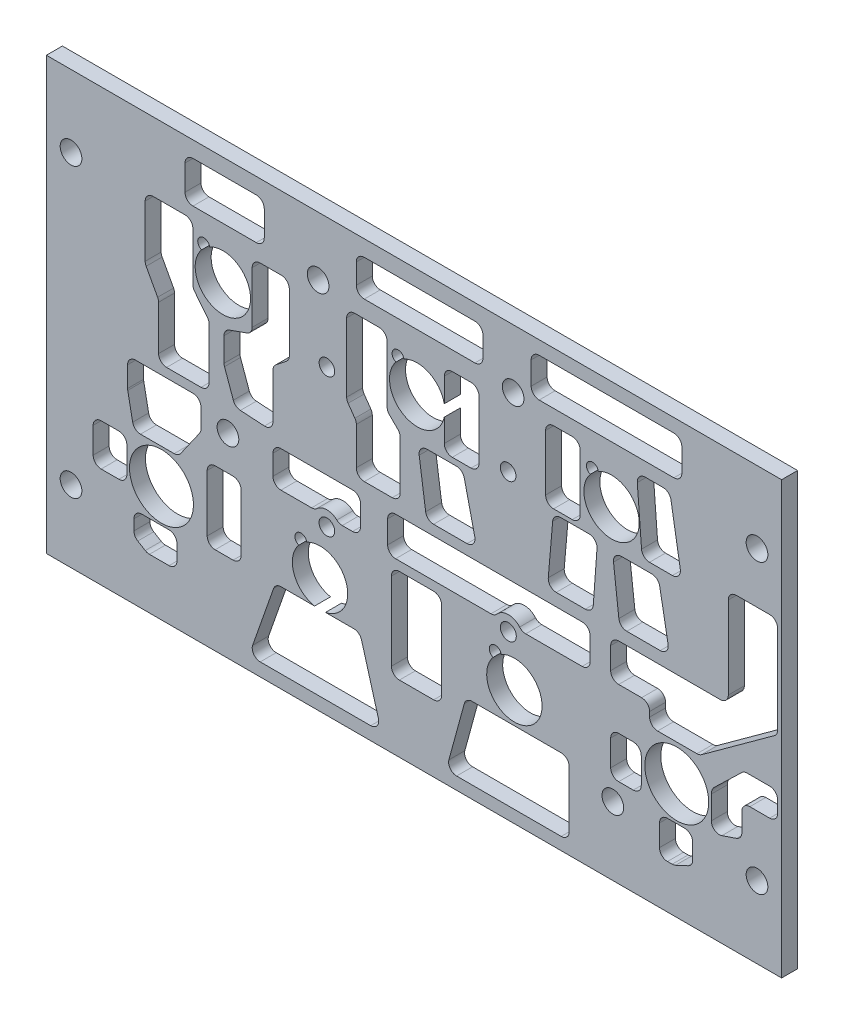
from build123d import *

# Parameters (mm, degrees)
SKETCH1_W                    = 146.05
SKETCH1_H                    = 85.725
BACKPLATE_BODY_DEPTH         = 3.175
F_6_CLEARANCE_HOLE1_D        = 4.3053
F_6_CLEARANCE_HOLE1_DEPTH    = 12.7
F_6_CLEARANCE_HOLE1_TIP      = 1.293442612
SKETCH4_R                    = 6.35
SWITCH_MOUNT_HOLES_DEPTH     = 170.379629088
SKETCH6_R                    = 1.55
SKETCH6_R_2                  = 1.554753364
SKETCH6_R_3                  = 1.586123296
BACKLIGHTING_LED_HOLES_DEPTH = 170.379629088


with BuildPart() as part:
    # Sketch1 → Backplate Body (new body)
    with BuildSketch(Plane.XY):
        with Locations((-73.025, 42.8625)):
            Rectangle(SKETCH1_W, SKETCH1_H)
    extrude(amount=-BACKPLATE_BODY_DEPTH)

    # #6 Clearance Hole1
    with Locations(Plane(origin=(0, 0, -3.175), x_dir=(-1, 0, 0), z_dir=(0, 0, -1))):
        with Locations((4.8895, 71.4375), (53.34, 74.041), (92.075, 74.041), (141.1605, 71.4375), (109.982, 38.735), (141.1605, 14.2875), (33.528, 13.589), (4.8895, 14.2875)):
            Hole(F_6_CLEARANCE_HOLE1_D / 2, depth=F_6_CLEARANCE_HOLE1_DEPTH)
            with Locations((0, 0, -(F_6_CLEARANCE_HOLE1_DEPTH + F_6_CLEARANCE_HOLE1_TIP / 2))):  # 118° drill point
                Cone(0, F_6_CLEARANCE_HOLE1_D / 2, F_6_CLEARANCE_HOLE1_TIP, mode=Mode.SUBTRACT)

    # Sketch4 → Switch Mount Holes (cut, through all)
    with BuildSketch(Plane(origin=(0, 0, -3.175), x_dir=(-1, 0, 0), z_dir=(0, 0, -1))):
        with Locations((20.828, 22.987)):
            Circle(SKETCH4_R)
        with Locations((123.19, 22.987)):
            Circle(SKETCH4_R)
        with BuildLine():
            ThreePointArc((36.406941459, 68.968185527), (30.298405182, 59.878878862), (38.000993537, 67.663469007))
            ThreePointArc((38.000993537, 67.663469007), (38.336404362, 69.699394738), (36.406941459, 68.968185527))
        make_face()
        with BuildLine():
            ThreePointArc((75.014941459, 68.968185527), (68.906405182, 59.878878862), (76.608993537, 67.663469007))
            ThreePointArc((76.608993537, 67.663469007), (76.944404362, 69.699394738), (75.014941459, 68.968185527))
        make_face()
        with BuildLine():
            ThreePointArc((113.622941459, 68.968185527), (107.514405182, 59.878878862), (115.216993537, 67.663469007))
            ThreePointArc((115.216993537, 67.663469007), (115.552404362, 69.699394738), (113.622941459, 68.968185527))
        make_face()
        with BuildLine():
            ThreePointArc((94.318941459, 27.820185527), (88.210405182, 18.730878862), (95.912993537, 26.515469007))
            ThreePointArc((95.912993537, 26.515469007), (96.248404362, 28.551394738), (94.318941459, 27.820185527))
        make_face()
        with BuildLine():
            ThreePointArc((55.710941459, 27.820185527), (49.602405182, 18.730878862), (57.304993537, 26.515469007))
            ThreePointArc((57.304993537, 26.515469007), (57.640404362, 28.551394738), (55.710941459, 27.820185527))
        make_face()
    extrude(amount=-SWITCH_MOUNT_HOLES_DEPTH, mode=Mode.SUBTRACT)

    # Sketch6 → Backlighting LED Holes (cut, through all)
    with BuildSketch(Plane(origin=(0, 0, -3.175), x_dir=(-1, 0, 0), z_dir=(0, 0, -1))):
        with Locations((90.3252, 59.937)):
            Circle(SKETCH6_R)
        with Locations((54.3252, 59.937)):
            Circle(SKETCH6_R)
        with Locations((90.329514846, 32.438994135)):
            Circle(SKETCH6_R_2)
        with Locations((54.290856695, 32.42580045)):
            Circle(SKETCH6_R_3)
        with BuildLine():
            Line((0.785426433, 59.749744345), (0.785426433, 42.262673755))
            ThreePointArc((0.785426433, 42.262673755), (0.958424834, 41.542020249), (1.439714906, 40.978433709))
            Line((1.439714906, 40.978433709), (15.887321534, 30.479872262))
            ThreePointArc((15.887321534, 30.479872262), (16.329908369, 30.254329655), (16.820533061, 30.176612309))
            Line((16.820533061, 30.176612309), (24.63882498, 30.176612309))
            ThreePointArc((24.63882498, 30.176612309), (25.761356995, 30.641580293), (26.22632498, 31.764112309))
            Line((26.22632498, 31.764112309), (26.22632498, 32.732935131))
            ThreePointArc((26.22632498, 32.732935131), (26.691292965, 33.855467146), (27.81382498, 34.320435131))
            Line((27.81382498, 34.320435131), (32.367304405, 34.320435131))
            ThreePointArc((32.367304405, 34.320435131), (33.48983642, 34.785403115), (33.954804405, 35.907935131))
            Line((33.954804405, 35.907935131), (33.954804405, 40.215556192))
            ThreePointArc((33.954804405, 40.215556192), (33.48983642, 41.338088207), (32.367304405, 41.803056192))
            Line((32.367304405, 41.803056192), (12.174303624, 41.803056192))
            ThreePointArc((12.174303624, 41.803056192), (11.051771609, 42.268024177), (10.586803624, 43.390556192))
            Line((10.586803624, 43.390556192), (10.586803624, 59.749744345))
            ThreePointArc((10.586803624, 59.749744345), (10.121835639, 60.872276361), (8.999303624, 61.337244345))
            Line((8.999303624, 61.337244345), (2.372926433, 61.337244345))
            ThreePointArc((2.372926433, 61.337244345), (1.250394418, 60.872276361), (0.785426433, 59.749744345))
        make_face()
        with BuildLine():
            Line((21.400023786, 75.350644356), (48.166754567, 75.350644356))
            ThreePointArc((48.166754567, 75.350644356), (49.289286582, 75.815612341), (49.754254567, 76.938144356))
            Line((49.754254567, 76.938144356), (49.754254567, 81.462446557))
            ThreePointArc((49.754254567, 81.462446557), (49.289286582, 82.584978572), (48.166754567, 83.049946557))
            Line((48.166754567, 83.049946557), (21.400023786, 83.049946557))
            ThreePointArc((21.400023786, 83.049946557), (20.277491771, 82.584978572), (19.812523786, 81.462446557))
            Line((19.812523786, 81.462446557), (19.812523786, 76.938144356))
            ThreePointArc((19.812523786, 76.938144356), (20.277491771, 75.815612341), (21.400023786, 75.350644356))
        make_face()
        with BuildLine():
            Line((59.335608416, 80.949159744), (59.335608416, 76.938144356))
            ThreePointArc((59.335608416, 76.938144356), (59.800576401, 75.815612341), (60.923108416, 75.350644356))
            Line((60.923108416, 75.350644356), (82.899162272, 75.350644356))
            ThreePointArc((82.899162272, 75.350644356), (84.021694287, 75.815612341), (84.486662272, 76.938144356))
            Line((84.486662272, 76.938144356), (84.486662272, 80.949159744))
            ThreePointArc((84.486662272, 80.949159744), (84.021694287, 82.071691759), (82.899162272, 82.536659744))
            Line((82.899162272, 82.536659744), (60.923108416, 82.536659744))
            ThreePointArc((60.923108416, 82.536659744), (59.800576401, 82.071691759), (59.335608416, 80.949159744))
        make_face()
        with BuildLine():
            Line((28.672038794, 70.907405635), (27.827187397, 59.864083676))
            ThreePointArc((27.827187397, 59.864083676), (27.323181945, 58.820620008), (26.244312737, 58.39767893))
            Line((26.244312737, 58.39767893), (21.689837718, 58.39767893))
            ThreePointArc((21.689837718, 58.39767893), (20.477644793, 58.960120608), (20.124397158, 60.248906253))
            Line((20.124397158, 60.248906253), (21.984848336, 71.292228211))
            ThreePointArc((21.984848336, 71.292228211), (22.525230575, 72.240693813), (23.550288897, 72.616000888))
            Line((23.550288897, 72.616000888), (27.089164134, 72.616000888))
            ThreePointArc((27.089164134, 72.616000888), (28.253723056, 72.107370096), (28.672038794, 70.907405635))
        make_face()
        with BuildLine():
            Line((46.876657313, 70.768971278), (46.876657313, 59.657488306))
            ThreePointArc((46.876657313, 59.657488306), (46.411689328, 58.534956291), (45.289157313, 58.069988306))
            Line((45.289157313, 58.069988306), (41.589305112, 58.069988306))
            ThreePointArc((41.589305112, 58.069988306), (40.466773097, 58.534956291), (40.001805112, 59.657488306))
            Line((40.001805112, 59.657488306), (40.001805112, 70.768971278))
            ThreePointArc((40.001805112, 70.768971278), (40.466773097, 71.891503293), (41.589305112, 72.356471278))
            Line((41.589305112, 72.356471278), (45.289157313, 72.356471278))
            ThreePointArc((45.289157313, 72.356471278), (46.411689328, 71.891503293), (46.876657313, 70.768971278))
        make_face()
        with BuildLine():
            Line((38.257624234, 57.278936968), (43.899609621, 57.278936968))
            ThreePointArc((43.899609621, 57.278936968), (44.972919639, 56.861121479), (45.481258886, 55.827605448))
            Line((45.481258886, 55.827605448), (46.355042782, 45.678269417))
            ThreePointArc((46.355042782, 45.678269417), (45.943078029, 44.46879092), (44.773393518, 43.954600938))
            Line((44.773393518, 43.954600938), (38.996979839, 43.954600938))
            ThreePointArc((38.996979839, 43.954600938), (37.915995587, 44.379505008), (37.413675408, 45.42676088))
            Line((37.413675408, 45.42676088), (36.674319803, 55.57609691))
            ThreePointArc((36.674319803, 55.57609691), (37.095028304, 56.77242122), (38.257624234, 57.278936968))
        make_face()
        with BuildLine():
            Line((24.219405423, 55.322692813), (22.548618943, 46.144830152))
            ThreePointArc((22.548618943, 46.144830152), (22.891532306, 44.843453603), (24.110449966, 44.273006203))
            Line((24.110449966, 44.273006203), (30.755280984, 44.273006203))
            ThreePointArc((30.755280984, 44.273006203), (31.811296344, 44.675184386), (32.3322486, 45.67794282))
            Line((32.3322486, 45.67794282), (33.394757201, 54.855805481))
            ThreePointArc((33.394757201, 54.855805481), (33.003111402, 56.094384224), (31.817789585, 56.625868864))
            Line((31.817789585, 56.625868864), (25.781236445, 56.625868864))
            ThreePointArc((25.781236445, 56.625868864), (24.764183846, 56.257286523), (24.219405423, 55.322692813))
        make_face()
        with BuildLine():
            Line((61.696291351, 71.619042996), (65.423676389, 71.619042996))
            ThreePointArc((65.423676389, 71.619042996), (66.546208404, 71.154075011), (67.011176389, 70.031542996))
            Line((67.011176389, 70.031542996), (67.011176389, 58.459819075))
            ThreePointArc((67.011176389, 58.459819075), (66.546208404, 57.337287059), (65.423676389, 56.872319075))
            Line((65.423676389, 56.872319075), (61.696291351, 56.872319075))
            ThreePointArc((61.696291351, 56.872319075), (60.573759336, 57.337287059), (60.108791351, 58.459819075))
            Line((60.108791351, 58.459819075), (60.108791351, 70.031542996))
            ThreePointArc((60.108791351, 70.031542996), (60.573759336, 71.154075011), (61.696291351, 71.619042996))
        make_face()
        with BuildLine():
            Line((78.368407935, 70.36568954), (78.368407935, 59.05524296))
            ThreePointArc((78.368407935, 59.05524296), (78.247566693, 58.447733011), (77.90343995, 57.932710945))
            Line((77.90343995, 57.932710945), (76.230642306, 56.259913301))
            ThreePointArc((76.230642306, 56.259913301), (75.886515563, 55.744891235), (75.765674321, 55.137381286))
            Line((75.765674321, 55.137381286), (75.765674321, 45.542100938))
            ThreePointArc((75.765674321, 45.542100938), (76.230642306, 44.419568923), (77.353174321, 43.954600938))
            Line((77.353174321, 43.954600938), (82.899162272, 43.954600938))
            ThreePointArc((82.899162272, 43.954600938), (84.021694287, 44.419568923), (84.486662272, 45.542100938))
            Line((84.486662272, 45.542100938), (84.486662272, 52.998183864))
            ThreePointArc((84.486662272, 52.998183864), (84.560211531, 53.475791866), (84.774044197, 53.909144479))
            Line((84.774044197, 53.909144479), (86.112563646, 55.819472215))
            ThreePointArc((86.112563646, 55.819472215), (86.326396312, 56.252824828), (86.399945571, 56.730432829))
            Line((86.399945571, 56.730432829), (86.399945571, 70.36568954))
            ThreePointArc((86.399945571, 70.36568954), (85.934977586, 71.488221555), (84.812445571, 71.95318954))
            Line((84.812445571, 71.95318954), (79.955907935, 71.95318954))
            ThreePointArc((79.955907935, 71.95318954), (78.83337592, 71.488221555), (78.368407935, 70.36568954))
        make_face()
        with BuildLine():
            Line((64.588095544, 55.752113711), (70.427150872, 55.752113711))
            ThreePointArc((70.427150872, 55.752113711), (71.625875842, 55.205389718), (71.998935675, 53.941793643))
            Line((71.998935675, 53.941793643), (70.710255392, 44.851373271))
            ThreePointArc((70.710255392, 44.851373271), (70.179246596, 43.875468368), (69.138470589, 43.486693338))
            Line((69.138470589, 43.486693338), (62.498343735, 43.486693338))
            ThreePointArc((62.498343735, 43.486693338), (61.256414725, 44.085371522), (60.951198538, 45.429858901))
            Line((60.951198538, 45.429858901), (63.040950348, 54.520279273))
            ThreePointArc((63.040950348, 54.520279273), (63.599273728, 55.406542721), (64.588095544, 55.752113711))
        make_face()
        with BuildLine():
            Line((104.361744188, 82.536659744), (116.930573023, 82.536659744))
            ThreePointArc((116.930573023, 82.536659744), (118.053105038, 82.071691759), (118.518073023, 80.949159744))
            Line((118.518073023, 80.949159744), (118.518073023, 75.923861258))
            ThreePointArc((118.518073023, 75.923861258), (118.053105038, 74.801329243), (116.930573023, 74.336361258))
            Line((116.930573023, 74.336361258), (104.361744188, 74.336361258))
            ThreePointArc((104.361744188, 74.336361258), (103.239212173, 74.801329243), (102.774244188, 75.923861258))
            Line((102.774244188, 75.923861258), (102.774244188, 80.949159744))
            ThreePointArc((102.774244188, 80.949159744), (103.239212173, 82.071691759), (104.361744188, 82.536659744))
        make_face()
        with BuildLine():
            Line((116.95152289, 70.450832848), (116.95152289, 60.794979539))
            ThreePointArc((116.95152289, 60.794979539), (116.861825101, 60.268914157), (116.602868041, 59.80229684))
            Line((116.602868041, 59.80229684), (114.088749966, 56.664735371))
            ThreePointArc((114.088749966, 56.664735371), (113.829792906, 56.198118054), (113.740095118, 55.672052672))
            Line((113.740095118, 55.672052672), (113.740095118, 45.542100938))
            ThreePointArc((113.740095118, 45.542100938), (114.205063103, 44.419568923), (115.327595118, 43.954600938))
            Line((115.327595118, 43.954600938), (122.178515967, 43.954600938))
            ThreePointArc((122.178515967, 43.954600938), (123.301047983, 44.419568923), (123.766015967, 45.542100938))
            Line((123.766015967, 45.542100938), (123.766015967, 54.374328078))
            ThreePointArc((123.766015967, 54.374328078), (123.814740935, 54.764619826), (123.957924816, 55.130953208))
            Line((123.957924816, 55.130953208), (126.237242345, 59.335142635))
            ThreePointArc((126.237242345, 59.335142635), (126.380426226, 59.701476017), (126.429151193, 60.091767765))
            Line((126.429151193, 60.091767765), (126.429151193, 70.450832848))
            ThreePointArc((126.429151193, 70.450832848), (125.964183208, 71.573364863), (124.841651193, 72.038332848))
            Line((124.841651193, 72.038332848), (118.53902289, 72.038332848))
            ThreePointArc((118.53902289, 72.038332848), (117.416490875, 71.573364863), (116.95152289, 70.450832848))
        make_face()
        with BuildLine():
            Line((105.172177173, 69.626168048), (105.172177173, 59.350951298))
            ThreePointArc((105.172177173, 59.350951298), (105.461527092, 58.437188409), (106.22409858, 57.856524378))
            Line((106.22409858, 57.856524378), (109.711728458, 56.606613876))
            ThreePointArc((109.711728458, 56.606613876), (110.474299946, 56.025949844), (110.763649865, 55.112186955))
            Line((110.763649865, 55.112186955), (110.763649865, 50.367987979))
            ThreePointArc((110.763649865, 50.367987979), (110.740208526, 50.096185189), (110.670576786, 49.832409386))
            Line((110.670576786, 49.832409386), (108.916673371, 44.938486226))
            ThreePointArc((108.916673371, 44.938486226), (108.375932915, 44.204955534), (107.520923995, 43.88963464))
            Line((107.520923995, 43.88963464), (102.737216586, 43.591707659))
            ThreePointArc((102.737216586, 43.591707659), (101.55145449, 44.019243969), (101.051039042, 45.176137838))
            Line((101.051039042, 45.176137838), (101.051039042, 54.014758396))
            ThreePointArc((101.051039042, 54.014758396), (100.894629541, 54.701880098), (100.456221741, 55.253603548))
            Line((100.456221741, 55.253603548), (98.391783299, 56.907831538))
            ThreePointArc((98.391783299, 56.907831538), (97.953375498, 57.459554988), (97.796965998, 58.146676689))
            Line((97.796965998, 58.146676689), (97.796965998, 69.626168048))
            ThreePointArc((97.796965998, 69.626168048), (98.261933983, 70.748700063), (99.384465998, 71.213668048))
            Line((99.384465998, 71.213668048), (103.584677173, 71.213668048))
            ThreePointArc((103.584677173, 71.213668048), (104.707209188, 70.748700063), (105.172177173, 69.626168048))
        make_face()
        with BuildLine():
            Line((39.626935681, 33.790848784), (50.842016714, 33.790848784))
            ThreePointArc((50.842016714, 33.790848784), (51.505798552, 33.936284319), (52.047958384, 34.34594337))
            ThreePointArc((52.047958384, 34.34594337), (54.290856695, 35.378348784), (56.533755006, 34.34594337))
            ThreePointArc((56.533755006, 34.34594337), (57.075914839, 33.936284319), (57.739696676, 33.790848784))
            Line((57.739696676, 33.790848784), (76.679009402, 33.790848784))
            ThreePointArc((76.679009402, 33.790848784), (77.801541417, 34.255816769), (78.266509402, 35.378348784))
            Line((78.266509402, 35.378348784), (78.266509402, 39.866381852))
            ThreePointArc((78.266509402, 39.866381852), (77.801541417, 40.988913867), (76.679009402, 41.453881852))
            Line((76.679009402, 41.453881852), (39.626935681, 41.453881852))
            ThreePointArc((39.626935681, 41.453881852), (38.504403665, 40.988913867), (38.039435681, 39.866381852))
            Line((38.039435681, 39.866381852), (38.039435681, 35.378348784))
            ThreePointArc((38.039435681, 35.378348784), (38.504403665, 34.255816769), (39.626935681, 33.790848784))
        make_face()
        with BuildLine():
            Line((83.642014846, 39.760843317), (83.642014846, 35.788315297))
            ThreePointArc((83.642014846, 35.788315297), (84.106982831, 34.665783282), (85.229514846, 34.200815297))
            Line((85.229514846, 34.200815297), (87.28411491, 34.200815297))
            ThreePointArc((87.28411491, 34.200815297), (87.856630207, 34.30764569), (88.352090972, 34.613758622))
            ThreePointArc((88.352090972, 34.613758622), (90.329514846, 35.378348784), (92.306938721, 34.613758622))
            ThreePointArc((92.306938721, 34.613758622), (92.802399486, 34.30764569), (93.374914782, 34.200815297))
            Line((93.374914782, 34.200815297), (99.463539042, 34.200815297))
            ThreePointArc((99.463539042, 34.200815297), (100.586071057, 34.665783282), (101.051039042, 35.788315297))
            Line((101.051039042, 35.788315297), (101.051039042, 39.760843317))
            ThreePointArc((101.051039042, 39.760843317), (100.586071057, 40.883375332), (99.463539042, 41.348343317))
            Line((99.463539042, 41.348343317), (85.229514846, 41.348343317))
            ThreePointArc((85.229514846, 41.348343317), (84.106982831, 40.883375332), (83.642014846, 39.760843317))
        make_face()
        with BuildLine():
            Line((115.345809004, 40.539297988), (115.345809004, 36.801804043))
            ThreePointArc((115.345809004, 36.801804043), (115.419245804, 36.324552666), (115.63276192, 35.891456015))
            Line((115.63276192, 35.891456015), (119.368084636, 30.555075958))
            ThreePointArc((119.368084636, 30.555075958), (119.93549505, 30.057351945), (120.66863172, 29.877923986))
            Line((120.66863172, 29.877923986), (127.357154785, 29.877923986))
            ThreePointArc((127.357154785, 29.877923986), (128.366421397, 30.240051734), (128.915236424, 31.161223633))
            Line((128.915236424, 31.161223633), (129.889388603, 36.150726788))
            ThreePointArc((129.889388603, 36.150726788), (129.911435258, 36.302117378), (129.918806964, 36.454927142))
            Line((129.918806964, 36.454927142), (129.918806964, 40.539297988))
            ThreePointArc((129.918806964, 40.539297988), (129.453838979, 41.661830003), (128.331306964, 42.126797988))
            Line((128.331306964, 42.126797988), (116.933309004, 42.126797988))
            ThreePointArc((116.933309004, 42.126797988), (115.810776989, 41.661830003), (115.345809004, 40.539297988))
        make_face()
        with BuildLine():
            Line((0.785426433, 30.234435945), (0.785426433, 27.901469923))
            ThreePointArc((0.785426433, 27.901469923), (1.250394418, 26.778937907), (2.372926433, 26.313969923))
            Line((2.372926433, 26.313969923), (6.315595781, 26.313969923))
            ThreePointArc((6.315595781, 26.313969923), (7.438127796, 25.849001938), (7.903095781, 24.726469923))
            Line((7.903095781, 24.726469923), (7.903095781, 21.040936804))
            ThreePointArc((7.903095781, 21.040936804), (8.199700392, 20.116953393), (8.978680466, 19.538239576))
            Line((8.978680466, 19.538239576), (11.871474027, 18.552768053))
            ThreePointArc((11.871474027, 18.552768053), (13.307372753, 18.764569892), (13.970889342, 20.055465281))
            Line((13.970889342, 20.055465281), (13.970889342, 24.657535192))
            ThreePointArc((13.970889342, 24.657535192), (13.805608325, 25.469507274), (13.336068845, 26.152258439))
            Line((13.336068845, 26.152258439), (7.921599209, 31.376823001))
            ThreePointArc((7.921599209, 31.376823001), (7.413677317, 31.706457633), (6.819279807, 31.821935945))
            Line((6.819279807, 31.821935945), (2.372926433, 31.821935945))
            ThreePointArc((2.372926433, 31.821935945), (1.250394418, 31.35696796), (0.785426433, 30.234435945))
        make_face()
        with BuildLine():
            Line((18.582773294, 10.016745037), (21.070326225, 8.857947088))
            ThreePointArc((21.070326225, 8.857947088), (21.397378928, 8.747033079), (21.74067813, 8.709469177))
            Line((21.74067813, 8.709469177), (22.673627884, 8.709469177))
            ThreePointArc((22.673627884, 8.709469177), (23.796159899, 9.174437162), (24.261127884, 10.296969177))
            Line((24.261127884, 10.296969177), (24.261127884, 14.547506632))
            ThreePointArc((24.261127884, 14.547506632), (23.796159899, 15.670038648), (22.673627884, 16.135006632))
            Line((22.673627884, 16.135006632), (19.253125199, 16.135006632))
            ThreePointArc((19.253125199, 16.135006632), (18.130593184, 15.670038648), (17.665625199, 14.547506632))
            Line((17.665625199, 14.547506632), (17.665625199, 11.455767126))
            ThreePointArc((17.665625199, 11.455767126), (17.91440568, 10.602545994), (18.582773294, 10.016745037))
        make_face()
        with BuildLine():
            Line((27.881901798, 24.309491603), (27.881901798, 19.183381997))
            ThreePointArc((27.881901798, 19.183381997), (28.346869783, 18.060849982), (29.469401798, 17.595881997))
            Line((29.469401798, 17.595881997), (32.367304405, 17.595881997))
            ThreePointArc((32.367304405, 17.595881997), (33.48983642, 18.060849982), (33.954804405, 19.183381997))
            Line((33.954804405, 19.183381997), (33.954804405, 24.309491603))
            ThreePointArc((33.954804405, 24.309491603), (33.48983642, 25.432023618), (32.367304405, 25.896991603))
            Line((32.367304405, 25.896991603), (29.469401798, 25.896991603))
            ThreePointArc((29.469401798, 25.896991603), (28.346869783, 25.432023618), (27.881901798, 24.309491603))
        make_face()
        with BuildLine():
            Line((43.779255464, 2.468354648), (64.568232739, 2.468354648))
            ThreePointArc((64.568232739, 2.468354648), (65.830132895, 3.092649454), (66.099531995, 4.474517804))
            Line((66.099531995, 4.474517804), (63.037286093, 15.674965732))
            ThreePointArc((63.037286093, 15.674965732), (62.469192031, 16.518202733), (61.505986837, 16.843802576))
            Line((61.505986837, 16.843802576), (43.779255464, 16.843802576))
            ThreePointArc((43.779255464, 16.843802576), (42.656723449, 16.378834591), (42.191755464, 15.256302576))
            Line((42.191755464, 15.256302576), (42.191755464, 4.055854648))
            ThreePointArc((42.191755464, 4.055854648), (42.656723449, 2.933322633), (43.779255464, 2.468354648))
        make_face()
        with BuildLine():
            Line((67.535901003, 30.388994135), (67.535901003, 14.880457769))
            ThreePointArc((67.535901003, 14.880457769), (68.000868988, 13.757925754), (69.123401003, 13.292957769))
            Line((69.123401003, 13.292957769), (75.929514846, 13.292957769))
            ThreePointArc((75.929514846, 13.292957769), (77.052046862, 13.757925754), (77.517014846, 14.880457769))
            Line((77.517014846, 14.880457769), (77.517014846, 30.388994135))
            ThreePointArc((77.517014846, 30.388994135), (77.052046862, 31.51152615), (75.929514846, 31.976494135))
            Line((75.929514846, 31.976494135), (69.123401003, 31.976494135))
            ThreePointArc((69.123401003, 31.976494135), (68.000868988, 31.51152615), (67.535901003, 30.388994135))
        make_face()
        with BuildLine():
            Line((83.450562292, 16.441087711), (80.100380971, 4.615416688))
            ThreePointArc((80.100380971, 4.615416688), (80.361462639, 3.225309301), (81.627771561, 2.595210974))
            Line((81.627771561, 2.595210974), (103.578012308, 2.595210974))
            ThreePointArc((103.578012308, 2.595210974), (104.873002433, 3.26447526), (105.076098837, 4.707966152))
            Line((105.076098837, 4.707966152), (100.929813014, 16.533637175))
            ThreePointArc((100.929813014, 16.533637175), (100.3499622, 17.303372121), (99.431726485, 17.595881997))
            Line((99.431726485, 17.595881997), (84.977952883, 17.595881997))
            ThreePointArc((84.977952883, 17.595881997), (84.020551209, 17.274690919), (83.450562292, 16.441087711))
        make_face()
        with BuildLine():
            Line((114.111100376, 30.264694353), (114.111100376, 18.998726199))
            ThreePointArc((114.111100376, 18.998726199), (113.646132392, 17.876194184), (112.523600376, 17.411226199))
            Line((112.523600376, 17.411226199), (108.961796592, 17.411226199))
            ThreePointArc((108.961796592, 17.411226199), (107.839264577, 17.876194184), (107.374296592, 18.998726199))
            Line((107.374296592, 18.998726199), (107.374296592, 30.264694353))
            ThreePointArc((107.374296592, 30.264694353), (107.839264577, 31.387226368), (108.961796592, 31.852194353))
            Line((108.961796592, 31.852194353), (112.523600376, 31.852194353))
            ThreePointArc((112.523600376, 31.852194353), (113.646132392, 31.387226368), (114.111100376, 30.264694353))
        make_face()
        with BuildLine():
            Line((130.071683152, 26.687660801), (130.071683152, 21.561325431))
            ThreePointArc((130.071683152, 21.561325431), (130.536651137, 20.438793415), (131.659183152, 19.973825431))
            Line((131.659183152, 19.973825431), (135.178450508, 19.973825431))
            ThreePointArc((135.178450508, 19.973825431), (136.300982523, 20.438793415), (136.765950508, 21.561325431))
            Line((136.765950508, 21.561325431), (136.765950508, 26.687660801))
            ThreePointArc((136.765950508, 26.687660801), (136.300982523, 27.810192817), (135.178450508, 28.275160801))
            Line((135.178450508, 28.275160801), (131.659183152, 28.275160801))
            ThreePointArc((131.659183152, 28.275160801), (130.536651137, 27.810192817), (130.071683152, 26.687660801))
        make_face()
        with BuildLine():
            Line((121.694193315, 16.253882812), (127.077184594, 16.253882812))
            ThreePointArc((127.077184594, 16.253882812), (128.199716609, 15.788914827), (128.664684594, 14.666382812))
            Line((128.664684594, 14.666382812), (128.664684594, 12.585143822))
            ThreePointArc((128.664684594, 12.585143822), (128.460825412, 11.806880154), (127.901605116, 11.228498307))
            Line((127.901605116, 11.228498307), (126.417136604, 10.326400971))
            ThreePointArc((126.417136604, 10.326400971), (126.020782371, 10.154349163), (125.592716082, 10.095546486))
            Line((125.592716082, 10.095546486), (121.694193315, 10.095546486))
            ThreePointArc((121.694193315, 10.095546486), (120.5716613, 10.56051447), (120.106693315, 11.683046486))
            Line((120.106693315, 11.683046486), (120.106693315, 14.666382812))
            ThreePointArc((120.106693315, 14.666382812), (120.5716613, 15.788914827), (121.694193315, 16.253882812))
        make_face()
    extrude(amount=-BACKLIGHTING_LED_HOLES_DEPTH, mode=Mode.SUBTRACT)


solid = part.part
